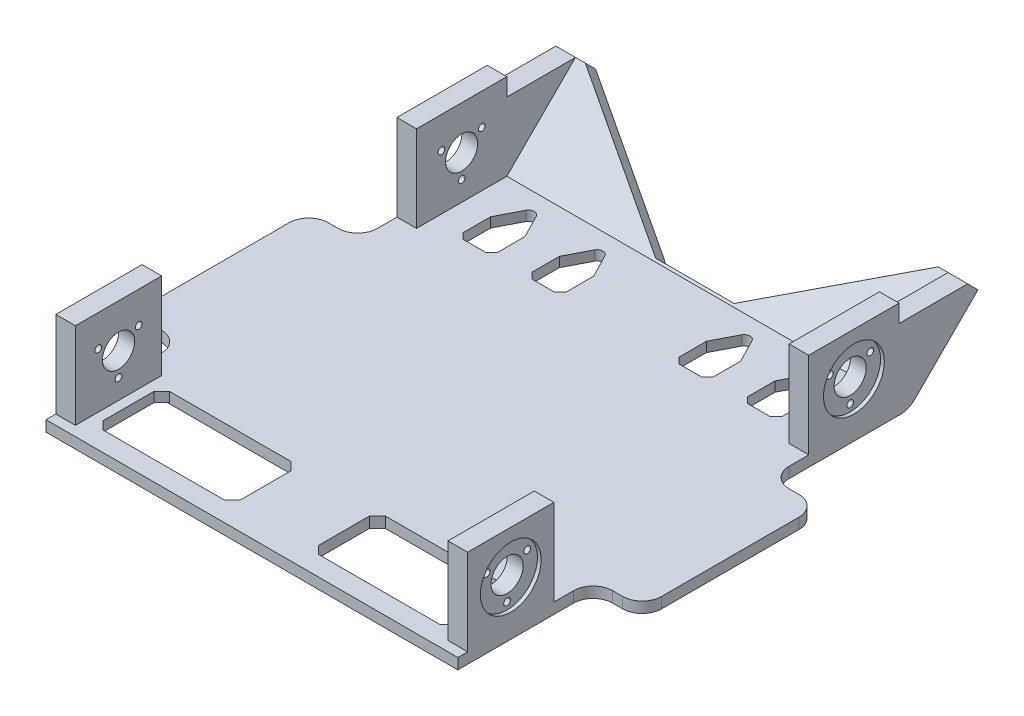
from build123d import *
from build123d.topology import SkipClean

# Parameters (mm, degrees)
SKETCH_1_W               = 5
SKETCH_1_H               = 10
EXTRUDE_1_DEPTH          = 5.5
SKETCH_3_W               = 5
SKETCH_3_H               = 46.066203836
SKETCH_3_H_2             = 44
EXTRUDE_2_DEPTH          = 44
CUT_EXTRUDE_1_DEPTH      = 316.357337
CUT_EXTRUDE_1_DEPTH_BACK = 316.357337
SKETCH_4_R               = 8.2
SKETCH_4_R_2             = 1.7
SKETCH_5_R               = 15.5
CUT_EXTRUDE_3_DEPTH      = 1.9
CUT_EXTRUDE_START        = -1.9
SKETCH_6_R               = 15.5
CUT_EXTRUDE_4_DEPTH      = 1.9
CUT_EXTRUDE_5_DEPTH      = 316.357337
CUT_EXTRUDE_5_DEPTH_BACK = 316.357337
SKETCH_7_R               = 8.2
SKETCH_7_R_2             = 1.7
SKETCH_8_R               = 15.5
CUT_EXTRUDE_6_DEPTH      = 1.9
SKETCH_9_R               = 15.5
CUT_EXTRUDE_7_DEPTH      = 1.9
SKETCH_10_W              = 10
SKETCH_10_H              = 34
EXTRUDE_3_DEPTH          = 5
SKETCH_11_W              = 5
SKETCH_11_H              = 41.066203836
SKETCH_11_H_2            = 5
SKETCH_11_H_3            = 44
EXTRUDE_4_DEPTH          = 44
CUT_EXTRUDE_8_DEPTH      = 315.095304008
CUT_EXTRUDE_8_DEPTH_BACK = 315.095304008
SKETCH_12_R              = 1.7
SKETCH_12_R_2            = 8.2
SKETCH_17_W              = 210
SKETCH_17_H              = 49.493882771
EXTRUDE_5_DEPTH          = 7.424621
EXTRUDE_6_DEPTH          = 10
EXTRUDE_8_DEPTH          = 10
SKETCH_20_W              = 40
SKETCH_20_H              = 48.239190952
CUT_EXTRUDE_9_DEPTH      = 10
EXTRUDE_11_DEPTH         = 5
EXTRUDE_13_DEPTH         = 210
FILLET_1_R               = 10
EXTRUDE_14_DEPTH         = 5
SKETCH_26_W              = 25
SKETCH_26_H              = 90
EXTRUDE_15_DEPTH         = 5.5
FILLET_2_R               = 10
CHAMFER_1_SIZE           = 4
CHAMFER_2_SIZE           = 3
FILLET_3_R               = 3


with BuildPart() as part:
    # 草图1 → 凸台-拉伸1 (new body)
    with BuildSketch(Plane(origin=(0, 0, 0), x_dir=(1, 0, 0), z_dir=(0, 1, 0))):
        Polygon((85, -44), (5, -44), (5, -186), (85, -186), (85, -220), (125, -220), (125, -186), (205, -186), (205, -44), (125, -44), (125, -10), (85, -10), align=None)
        Polygon((3, 0), (0, 0), (0, -10), (5, -10), (5, 0), align=None)
        Polygon((5, -10), (0, -10), (0, -220), (5, -220), (5, -186), (5, -44), align=None)
        Polygon((205, 0), (5, 0), (5, -10), (85, -10), (125, -10), (205, -10), align=None)
        Polygon((210, -10), (205, -10), (205, -44), (205, -186), (205, -220), (210, -220), align=None)
        with Locations((207.5, -5)):
            Rectangle(SKETCH_1_W, SKETCH_1_H)
        Polygon((85, -220), (5, -220), (5, -230), (205, -230), (205, -220), (125, -220), align=None)
        with Locations((2.5, -225)):
            Rectangle(SKETCH_1_W, SKETCH_1_H)
        with Locations((207.5, -225)):
            Rectangle(SKETCH_1_W, SKETCH_1_H)
    extrude(amount=EXTRUDE_1_DEPTH)

    # 草图3 → 凸台-拉伸2 (add)
    with BuildSketch(Plane(origin=(0, 5.5, 0), x_dir=(1, 0, 0), z_dir=(0, 1, 0))):
        with Locations((2.5, -28.033101918)):
            Rectangle(SKETCH_3_W, SKETCH_3_H)
        with Locations((2.5, -203)):
            Rectangle(SKETCH_3_W, SKETCH_3_H_2)
        with Locations((207.5, -203)):
            Rectangle(SKETCH_3_W, SKETCH_3_H_2)
        with Locations((207.5, -28.033101918)):
            Rectangle(SKETCH_3_W, SKETCH_3_H)
    extrude(amount=EXTRUDE_2_DEPTH)

    # 草图4 → 切除-拉伸1 (cut, two sides: drawn at the far end of the back side and taken through both)
    with BuildSketch(Plane.ZY.offset(-CUT_EXTRUDE_1_DEPTH_BACK)):
        with Locations((28.033101918, 27.5)):
            Circle(SKETCH_4_R)
        with Locations((28.033101918, 15.6)):
            Circle(SKETCH_4_R_2)
        with Locations((17.727399613, 33.45)):
            Circle(SKETCH_4_R_2)
        with Locations((38.338804223, 33.45)):
            Circle(SKETCH_4_R_2)
    extrude(amount=CUT_EXTRUDE_1_DEPTH + CUT_EXTRUDE_1_DEPTH_BACK, mode=Mode.SUBTRACT)

    # 草图5 → 切除-拉伸3 (cut)
    with BuildSketch(Plane.ZY):
        with Locations((28.033101918, 27.5)):
            Circle(SKETCH_5_R)
    extrude(amount=-CUT_EXTRUDE_3_DEPTH, mode=Mode.SUBTRACT)

    # 草图6 → 切除-拉伸4 (cut)
    with BuildSketch(Plane(origin=(210, 0, 0), x_dir=(0, 0, -1), z_dir=(1, 0, 0)).offset(CUT_EXTRUDE_START)):
        with Locations(Location((-28.033101918, 27.5, 0), (0, 0, 180))):
            Circle(SKETCH_6_R)
    extrude(amount=CUT_EXTRUDE_4_DEPTH, mode=Mode.SUBTRACT)

    # 草图7 → 切除-拉伸5 (cut, two sides: drawn at the far end of the back side and taken through both)
    with BuildSketch(Plane.ZY.offset(-CUT_EXTRUDE_5_DEPTH_BACK)):
        with Locations((203, 27.5)):
            Circle(SKETCH_7_R)
        with Locations((203, 15.6)):
            Circle(SKETCH_7_R_2)
        with Locations((192.694297695, 33.45)):
            Circle(SKETCH_7_R_2)
        with Locations((213.305702305, 33.45)):
            Circle(SKETCH_7_R_2)
    extrude(amount=CUT_EXTRUDE_5_DEPTH + CUT_EXTRUDE_5_DEPTH_BACK, mode=Mode.SUBTRACT)

    # 草图8 → 切除-拉伸6 (cut)
    with BuildSketch(Plane.ZY):
        with Locations((203, 27.5)):
            Circle(SKETCH_8_R)
    extrude(amount=-CUT_EXTRUDE_6_DEPTH, mode=Mode.SUBTRACT)

    # 草图9 → 切除-拉伸7 (cut)
    with BuildSketch(Plane(origin=(210, 0, 0), x_dir=(0, 0, -1), z_dir=(1, 0, 0)).offset(CUT_EXTRUDE_START)):
        with Locations(Location((-203, 27.5, 0), (0, 0, 180))):
            Circle(SKETCH_9_R)
    extrude(amount=CUT_EXTRUDE_7_DEPTH, mode=Mode.SUBTRACT)

    # 草图10 → 凸台-拉伸3 (add)
    with BuildSketch(Plane(origin=(0, 5.5, 0), x_dir=(1, 0, 0), z_dir=(0, 1, 0))):
        with Locations((200, -27)):
            Rectangle(SKETCH_10_W, SKETCH_10_H)
        with Locations((10, -27)):
            Rectangle(SKETCH_10_W, SKETCH_10_H)
        with Locations((10, -203)):
            Rectangle(SKETCH_10_W, SKETCH_10_H)
        with Locations((200, -203)):
            Rectangle(SKETCH_10_W, SKETCH_10_H)
    extrude(amount=-EXTRUDE_3_DEPTH)

    # 草图11 → 凸台-拉伸4 (add)
    with BuildSketch(Plane(origin=(0, 5.5, 0), x_dir=(1, 0, 0), z_dir=(0, 1, 0))):
        with Locations((7.5, -30.533101918)):
            Rectangle(SKETCH_11_W, SKETCH_11_H)
        with Locations((7.5, -7.5)):
            Rectangle(SKETCH_11_W, SKETCH_11_H_2)
        with Locations((202.5, -7.5)):
            Rectangle(SKETCH_11_W, SKETCH_11_H_2)
        with Locations((202.5, -30.533101918)):
            Rectangle(SKETCH_11_W, SKETCH_11_H)
        with Locations((7.5, -203)):
            Rectangle(SKETCH_11_W, SKETCH_11_H_3)
        with Locations((202.5, -203)):
            Rectangle(SKETCH_11_W, SKETCH_11_H_3)
    extrude(amount=EXTRUDE_4_DEPTH)

    # 草图12 → 切除-拉伸8 (cut, two sides: drawn at the far end of the back side and taken through both)
    with BuildSketch(Plane.ZY.offset(-1.9).offset(-CUT_EXTRUDE_8_DEPTH_BACK)):
        with Locations(Location((17.727399613, 33.45, 0), (0, 0, 180))):
            Circle(SKETCH_12_R)
        with Locations(Location((38.338804223, 33.45, 0), (0, 0, 180))):
            Circle(SKETCH_12_R)
        with Locations(Location((28.033101918, 15.6, 0), (0, 0, 180))):
            Circle(SKETCH_12_R)
        with Locations(Location((28.033101918, 27.5, 0), (0, 0, 180))):
            Circle(SKETCH_12_R_2)
        with Locations(Location((192.694297695, 33.45, 0), (0, 0, 180))):
            Circle(SKETCH_12_R)
        with Locations(Location((213.305702305, 33.45, 0), (0, 0, 180))):
            Circle(SKETCH_12_R)
        with Locations(Location((203, 15.6, 0), (0, 0, 180))):
            Circle(SKETCH_12_R)
        with Locations(Location((203, 27.5, 0), (0, 0, 180))):
            Circle(SKETCH_12_R_2)
    extrude(amount=CUT_EXTRUDE_8_DEPTH + CUT_EXTRUDE_8_DEPTH_BACK, mode=Mode.SUBTRACT)

    # 草图17 → 凸台-拉伸5 (add, through all)
    with BuildSketch(Plane(origin=(0, 5.25, 5.25), x_dir=(1, 0, 0), z_dir=(0, 0.7071067811865464, 0.7071067811865487))):
        with Locations((105, 25.100494776)):
            Rectangle(SKETCH_17_W, SKETCH_17_H)
    extrude(amount=-EXTRUDE_5_DEPTH)

    # 草图18 → 凸台-拉伸6 (add)
    with BuildSketch(Plane.ZY):
        Polygon((-29.997460135, 40.497460135), (5, 40.5), (5, 5.5), align=None)
    extrude(amount=-EXTRUDE_6_DEPTH)

    # 草图19 → 凸台-拉伸8 (add)
    with BuildSketch(Plane(origin=(210, 0, 0), x_dir=(0, 0, -1), z_dir=(1, 0, 0))):
        Polygon((30, 40.5), (-5, 40.5), (-5, 5.5), align=None)
    extrude(amount=-EXTRUDE_8_DEPTH)

    # 草图20 → 切除-拉伸9 (cut)
    with BuildSketch(Plane(origin=(0, 5.25, 5.25), x_dir=(1, 0, 0), z_dir=(0, 0.7071067811865465, 0.7071067811865487))):
        Polygon((85, 49.847436162), (15, 49.847436162), (85, 1.60824521), align=None)
        with Locations((105, 25.727840686)):
            Rectangle(SKETCH_20_W, SKETCH_20_H)
        Polygon((125, 49.847436162), (125, 1.60824521), (195, 49.847436162), align=None)
    extrude(amount=-CUT_EXTRUDE_9_DEPTH, mode=Mode.SUBTRACT)

    # 草图21 → 凸台-拉伸11 (add)
    with BuildSketch(Plane(origin=(0, 5.5, 0), x_dir=(1, 0, 0), z_dir=(0, 1, 0))):
        Polygon((15, -44), (32.5, -10), (15, -10), align=None)
        Polygon((67.5, -10), (32.5, -10), (41.25, -27), (50, -44), (58.75, -27), align=None)
        Polygon((50, -44), (41.25, -27), (41.25, -44), align=None)
        Polygon((58.75, -27), (50, -44), (58.75, -44), align=None)
        Polygon((85, -10), (67.5, -10), (85, -44), align=None)
        Polygon((125, -10), (125, -44), (142.5, -10), align=None)
        Polygon((177.5, -10), (142.5, -10), (151.25, -27), (160, -44), (168.75, -27), align=None)
        Polygon((195, -10), (177.5, -10), (195, -44), align=None)
        Polygon((168.75, -27), (160, -44), (168.75, -44), align=None)
        Polygon((151.25, -27), (151.25, -44), (160, -44), align=None)
    extrude(amount=-EXTRUDE_11_DEPTH)

    # 草图22 → 凸台-拉伸13 (add)
    with SkipClean():  # the faces are left unmerged after this step: merging them gives an invalid solid
        with BuildSketch(Plane.ZY):
            Polygon((0, 0.5), (0, 0), (-0.25, 0.25), align=None)
        extrude(amount=-EXTRUDE_13_DEPTH)

    # 圆角1
    # the kernel refuses this fillet: 10 mm, written as the material it takes off along each edge
    with BuildSketch(Plane(origin=(220.355339059, 0, 0), x_dir=(0, 0, 1), z_dir=(-1, 0, 0))) as fillet_1_piece_1:
        with BuildLine():
            CenterArc((FILLET_1_R * 0.414213562373, FILLET_1_R), FILLET_1_R, 225, 45)
            Line((-FILLET_1_R * 0.292893218813, FILLET_1_R * 0.292893218813), (0, 0))
            Line((0, 0), (FILLET_1_R * 0.414213562373, 0))
        make_face()
    extrude(amount=230.710678119, mode=Mode.SUBTRACT)

    # 草图23 → 凸台-拉伸14 (add)
    with BuildSketch(Plane(origin=(0, 5.5, 0), x_dir=(1, 0, 0), z_dir=(0, 1, 0))):
        Polygon((23.75, -27), (23.75, -44), (15, -44), align=None)
        Polygon((76.25, -27), (76.25, -44), (85, -44), align=None)
        Polygon((133.75, -27), (133.75, -44), (125, -44), align=None)
        Polygon((186.25, -27), (186.25, -44), (195, -44), align=None)
    extrude(amount=-EXTRUDE_14_DEPTH)

    # 草图26 → 凸台-拉伸15 (add)
    with BuildSketch(Plane(origin=(0, 5.5, 0), x_dir=(1, 0, 0), z_dir=(0, 1, 0))):
        with Locations((-12.5, -116.033101918)):
            Rectangle(SKETCH_26_W, SKETCH_26_H)
        with Locations((222.5, -116.033101918)):
            Rectangle(SKETCH_26_W, SKETCH_26_H)
    extrude(amount=-EXTRUDE_15_DEPTH)

    # 圆角2
    fillet_2_edges = [part.edges().sort_by_distance(p)[0] for p in [
        (0, 2.75, 161.033101918),
        (-25, 2.75, 161.033101918),
        (-25, 2.75, 71.033101918),
        (0, 2.75, 71.033101918),
        (235, 2.75, 161.033101918),
        (210, 2.75, 161.033101918),
        (210, 2.75, 71.033101918),
        (235, 2.75, 71.033101918),
    ]]
    fillet(fillet_2_edges, radius=FILLET_2_R)

    # 倒角1
    chamfer_1_edges = [part.edges().sort_by_distance(p)[0] for p in [
        (15, 3, 186),
        (15, 3, 220),
        (195, 3, 220),
        (195, 3, 186),
        (85, 2.75, 220),
        (85, 2.75, 186),
        (125, 2.75, 186),
        (125, 2.75, 220),
    ]]
    chamfer(chamfer_1_edges, length=CHAMFER_1_SIZE)

    # 倒角2
    chamfer_2_edges = [part.edges().sort_by_distance(p)[0] for p in [
        (58.75, 3, 44),
        (41.25, 3, 44),
        (168.75, 3, 44),
        (151.25, 3, 44),
        (23.75, 3, 44),
        (76.25, 3, 44),
        (133.75, 3, 44),
        (186.25, 3, 44),
    ]]
    chamfer(chamfer_2_edges, length=CHAMFER_2_SIZE)

    # 圆角3
    fillet_3_edges = [part.edges().sort_by_distance(p)[0] for p in [
        (32.5, 3, 10),
        (67.5, 3, 10),
        (142.5, 3, 10),
        (177.5, 3, 10),
    ]]
    fillet(fillet_3_edges, radius=FILLET_3_R)


solid = part.part
